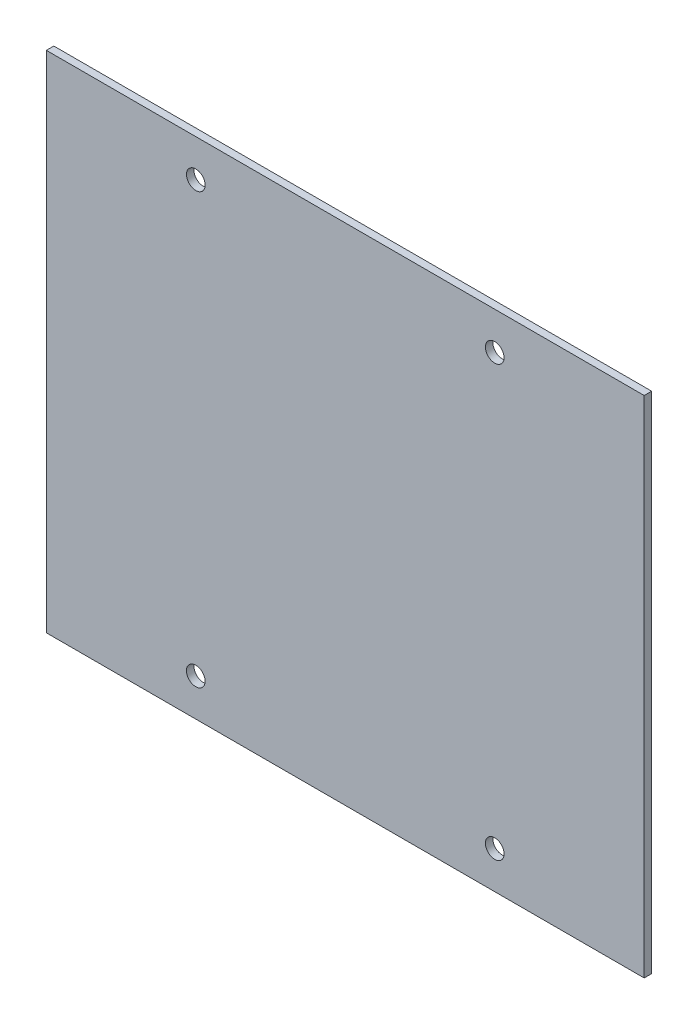
from build123d import *

# Parameters (mm, degrees)
IZIM1_W                     = 160
IZIM1_H                     = 135
IZIM1_R                     = 2.5
Y_KSEKLIK_EKSTR_ZYON1_DEPTH = 2


with BuildPart() as part:
    # Çizim1 → Yükseklik-Ekstrüzyon1 (new body)
    with BuildSketch(Plane.XY):
        with Locations((80, 67.5)):
            Rectangle(IZIM1_W, IZIM1_H)
        with Locations((40, 125)):
            Circle(IZIM1_R, mode=Mode.SUBTRACT)
        with Locations((120, 125)):
            Circle(IZIM1_R, mode=Mode.SUBTRACT)
        with Locations((40, 10)):
            Circle(IZIM1_R, mode=Mode.SUBTRACT)
        with Locations((120, 10)):
            Circle(IZIM1_R, mode=Mode.SUBTRACT)
    extrude(amount=Y_KSEKLIK_EKSTR_ZYON1_DEPTH)


solid = part.part
